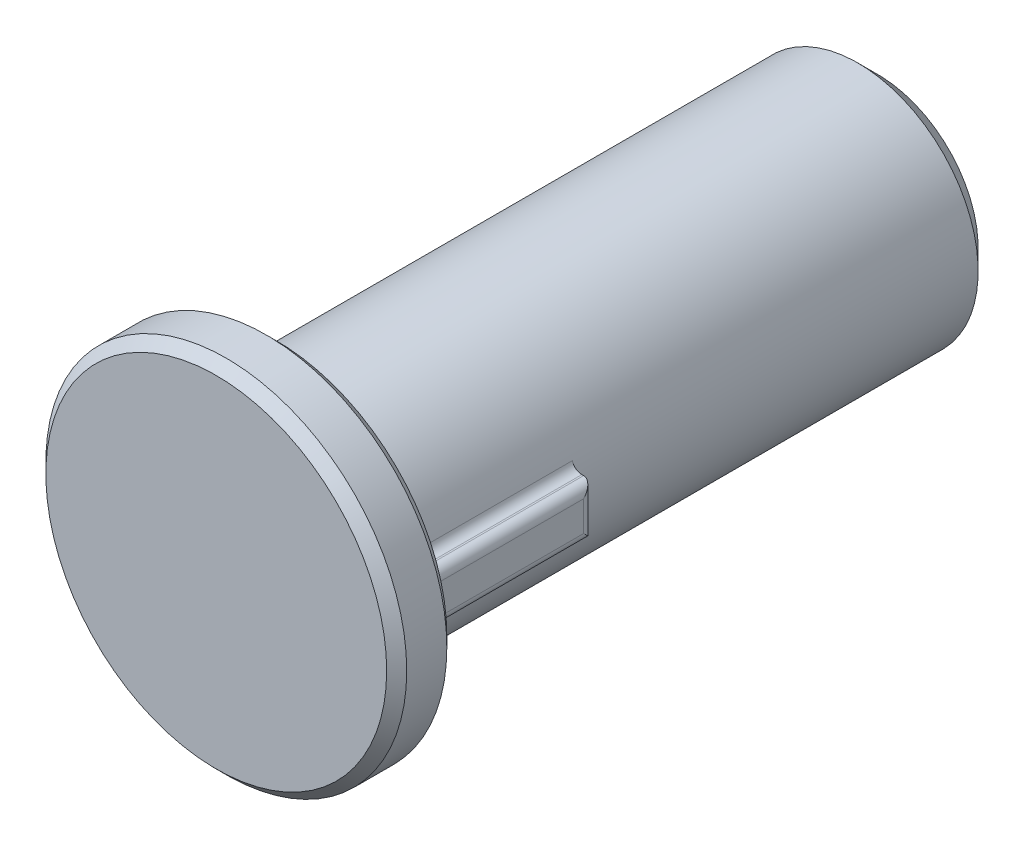
from build123d import *

# Parameters (mm, degrees)
SKETCH1_R           = 9
BOSS_EXTRUDE1_DEPTH = 3
SKETCH2_R           = 6
BOSS_EXTRUDE2_DEPTH = 30
SKETCH3_W           = 1.649682621
SKETCH3_H           = 2.5
BOSS_EXTRUDE3_DEPTH = 9
FILLET1_R           = 0.5
CHAMFER1_SIZE       = 0.5
CHAMFER2_SIZE       = 1
CUT_EXTRUDE1_DEPTH  = 10
CHAMFER3_SIZE       = 0.5


with BuildPart() as part:
    # Sketch1 → Boss-Extrude1 (new body)
    with BuildSketch(Plane.XY):
        Circle(SKETCH1_R)
    extrude(amount=BOSS_EXTRUDE1_DEPTH)

    # Sketch2 → Boss-Extrude2 (add)
    with BuildSketch(Plane(origin=(0, 0, 0), x_dir=(-1, 0, 0), z_dir=(0, 0, -1))):
        Circle(SKETCH2_R)
    extrude(amount=BOSS_EXTRUDE2_DEPTH)

    # Sketch3 → Boss-Extrude3 (add)
    with BuildSketch(Plane(origin=(0, 0, 0), x_dir=(-1, 0, 0), z_dir=(0, 0, -1))):
        with Locations((-5.999366701, 0.087173351)):
            Rectangle(SKETCH3_W, SKETCH3_H)
    extrude(amount=BOSS_EXTRUDE3_DEPTH)

    # Fillet1
    fillet1_edges = [part.edges().sort_by_distance(p)[0] for p in [
        (5.849099711, 1.337173351, -4.5),
        (5.886241091, -1.162826649, -4.5),
        (6.824208011, -1.162826649, -4.5),
        (6.824208011, 1.337173351, -4.5),
        (6.824208011, 0.087173351, -9),
    ]]
    fillet(fillet1_edges, radius=FILLET1_R)

    # Chamfer1
    chamfer1_edges = [part.edges().sort_by_distance(p)[0] for p in [
        (-9, 0, 0),
        (6.303958853, -1.162826649, 0),
        (-0.773923618, -5.949877497, 0),
        (6.824208011, 0.087173351, 0),
        (6.279586727, 1.337173351, 0),
        (5.935516377, 1.436760743, 0),
        (5.978713688, -1.266622868, 0),
        (6.677761402, -1.016380039, 0),
        (6.677761402, 1.190726742, 0),
        (-9, 0, 3),
    ]]
    chamfer(chamfer1_edges, length=CHAMFER1_SIZE - 0.0001)  # a hair under: the kernel refuses the full size

    # Chamfer2
    chamfer2_edges = [part.edges().sort_by_distance(p)[0] for p in [
        (6, 0, -30),
    ]]
    chamfer(chamfer2_edges, length=CHAMFER2_SIZE)

    # Sketch4 → Cut-Extrude1 (cut)
    with BuildSketch(Plane(origin=(0, 0, -30), x_dir=(-1, 0, 0), z_dir=(0, 0, -1))):
        with BuildLine():
            Line((-1.922298895, -2.303207971), (2.50253525, -1.654484005))
            ThreePointArc((2.50253525, -1.654484005), (-0.435177266, 2.968268982), (-1.922298895, -2.303207971))
        make_face()
    extrude(amount=-CUT_EXTRUDE1_DEPTH, mode=Mode.SUBTRACT)

    # Chamfer3
    chamfer3_edges = [part.edges().sort_by_distance(p)[0] for p in [
        (0.435177266, 2.968268982, -30),
        (-0.290118177, -1.978845988, -30),
    ]]
    chamfer(chamfer3_edges, length=CHAMFER3_SIZE)


solid = part.part
